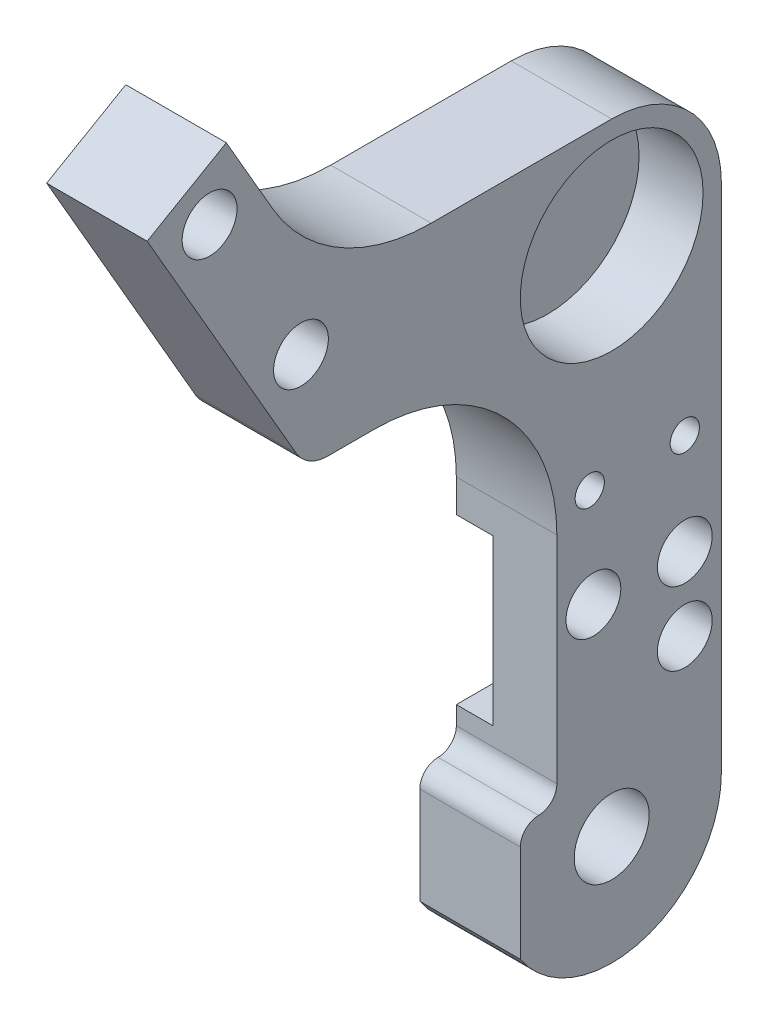
from build123d import *

# Parameters (mm, degrees)
SKETCH1_R                   = 2.05
SKETCH1_R_2                 = 1.5
BOSS_EXTRUDE1_DEPTH         = 5.5
FILLET1_START               = -1
FILLET1_DEPTH               = 7
FILLET1_2_DEPTH             = 5.5
TAP_DRILL_FOR_M2X0_4_TAP1_D = 1.6
SKETCH4_W                   = 9
SKETCH4_H                   = 9
CUT_EXTRUDE1_DEPTH          = 2
SKETCH5_R                   = 5
CUT_EXTRUDE2_DEPTH          = 3.5


with BuildPart() as part:
    # Sketch1 → Boss-Extrude1 (new body)
    with BuildSketch(Plane(origin=(0, 0, 0), x_dir=(0, 0, -1), z_dir=(1, 0, 0))):
        with BuildLine():
            Line((6, 0), (6, 28))
            ThreePointArc((6, 28), (4.242640687, 32.242640687), (0, 34))
            Line((0, 34), (-9.875644347, 34))
            ThreePointArc((-9.875644347, 34), (-14.875644347, 35.339745962), (-18.535898385, 39))
            Line((-18.535898385, 39), (-21.084936491, 43.415063509))
            Line((-21.084936491, 43.415063509), (-25.415063509, 40.915063509))
            Line((-25.415063509, 40.915063509), (-17.260063509, 26.790189174))
            ThreePointArc((-17.260063509, 26.790189174), (-16.528012702, 26.058138366), (-15.528012702, 25.790189174))
            Line((-15.528012702, 25.790189174), (-13, 25.790189174))
            ThreePointArc((-13, 25.790189174), (-5.928932188, 22.861256986), (-3, 15.790189174))
            Line((-3, 15.790189174), (-3, 3))
            Line((-3, 3), (-5, 3))
            Line((-5, 3), (-5, -3.31662479))
            ThreePointArc((-5, -3.31662479), (1.732050808, -5.744562647), (6, 0))
        make_face()
        Circle(SKETCH1_R, mode=Mode.SUBTRACT)
        with Locations((-22, 40)):
            Circle(SKETCH1_R_2, mode=Mode.SUBTRACT)
        with Locations((-17, 31.339745962)):
            Circle(SKETCH1_R_2, mode=Mode.SUBTRACT)
        with Locations((-1, 11.5)):
            Circle(SKETCH1_R_2, mode=Mode.SUBTRACT)
        with Locations((4, 11.5)):
            Circle(SKETCH1_R_2, mode=Mode.SUBTRACT)
        with Locations((4, 7.5)):
            Circle(SKETCH1_R_2, mode=Mode.SUBTRACT)
    extrude(amount=BOSS_EXTRUDE1_DEPTH)

    # Fillet1: read off the stored shape, not the designer's step
    # Fillet1 outline → Fillet1 (cut)
    with BuildSketch(Plane.YZ.offset(FILLET1_START)):
        with BuildLine():
            ThreePointArc((2, 5), (2.707106781, 4.707106781), (3, 4))
            Line((3, 4), (3, 5))
            Line((3, 5), (2, 5))
        make_face()
    extrude(amount=FILLET1_DEPTH, mode=Mode.SUBTRACT)

    # Fillet1 2 outline → Fillet1 2 (add)
    with BuildSketch(Plane.YZ):
        with BuildLine():
            ThreePointArc((4, 3), (3.292893219, 3.292893219), (3, 4))
            Line((3, 4), (3, 3))
            Line((3, 3), (4, 3))
        make_face()
    extrude(amount=FILLET1_2_DEPTH)

    # Tap Drill for M2x0.4 Tap1 (through all)
    with Locations(Plane(origin=(5.5, 0, 0), x_dir=(0, 0, -1), z_dir=(1, 0, 0))):
        with Locations((-1.2, 17), (4, 17)):
            Hole(TAP_DRILL_FOR_M2X0_4_TAP1_D / 2)

    # Sketch4 → Cut-Extrude1 (cut)
    with BuildSketch(Plane.ZY):
        with Locations((-1.5, 9.5)):
            Rectangle(SKETCH4_W, SKETCH4_H)
    extrude(amount=-CUT_EXTRUDE1_DEPTH, mode=Mode.SUBTRACT)

    # Sketch5 → Cut-Extrude2 (cut)
    with BuildSketch(Plane(origin=(5.5, 0, 0), x_dir=(0, 0, -1), z_dir=(1, 0, 0))):
        with Locations((0, 28)):
            Circle(SKETCH5_R)
    extrude(amount=-CUT_EXTRUDE2_DEPTH, mode=Mode.SUBTRACT)


solid = part.part
